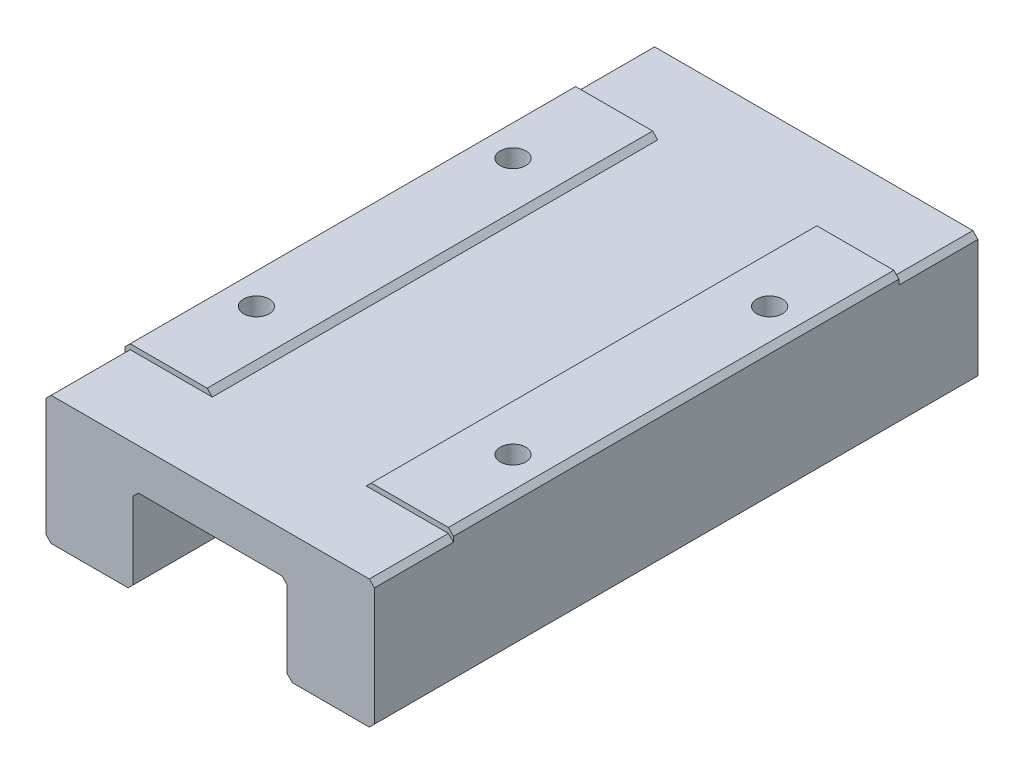
from build123d import *

# Parameters (mm, degrees)
SKETCH1_W                 = 32
SKETCH1_H                 = 43.4
SKETCH1_H_2               = 7.7
BOSS_EXTRUDE1_DEPTH       = 13
M3X0_5_TAPPED_HOLE1_D     = 2.5
M3X0_5_TAPPED_HOLE1_DEPTH = 6.5
M3X0_5_TAPPED_HOLE1_TIP   = 0.751075774
CUT_EXTRUDE1_DEPTH        = 69.194134645
SKETCH5_W                 = 15
SKETCH5_H                 = 43.4
CUT_EXTRUDE2_DEPTH        = 0.5
CHAMFER1_SIZE             = 0.5


with BuildPart() as part:
    # Sketch1 → Boss-Extrude1 (new body)
    with BuildSketch(Plane(origin=(0, 0, 0), x_dir=(1, 0, 0), z_dir=(0, 1, 0))):
        with Locations((16, 29.4)):
            Rectangle(SKETCH1_W, SKETCH1_H)
        with Locations((16, 3.85)):
            Rectangle(SKETCH1_W, SKETCH1_H_2)
        with Locations((16, 54.95)):
            Rectangle(SKETCH1_W, SKETCH1_H_2)
    extrude(amount=BOSS_EXTRUDE1_DEPTH)

    # M3x0.5 Tapped Hole1
    with Locations(Plane(origin=(0, 13, 0), x_dir=(1, 0, 0), z_dir=(0, 1, 0))):
        with Locations((28.5, 17), (28.5, 42), (3.5, 42), (3.5, 17)):
            Hole(M3X0_5_TAPPED_HOLE1_D / 2, depth=M3X0_5_TAPPED_HOLE1_DEPTH)
            with Locations((0, 0, -(M3X0_5_TAPPED_HOLE1_DEPTH + M3X0_5_TAPPED_HOLE1_TIP / 2))):  # 118° drill point
                Cone(0, M3X0_5_TAPPED_HOLE1_D / 2, M3X0_5_TAPPED_HOLE1_TIP, mode=Mode.SUBTRACT)

    # Sketch4 → Cut-Extrude1 (cut, through all)
    with BuildSketch(Plane.XY):
        Polygon((8.5, 8.5), (8.5, 0), (23.5, 0), (23.5, 8.5), (16, 8.5), align=None)
    extrude(amount=-CUT_EXTRUDE1_DEPTH, mode=Mode.SUBTRACT)

    # Sketch5 → Cut-Extrude2 (cut)
    with BuildSketch(Plane(origin=(0, 13, 0), x_dir=(1, 0, 0), z_dir=(0, 1, 0))):
        Polygon((0, 58.8), (0, 51.1), (8.5, 51.1), (23.5, 51.1), (32, 51.1), (32, 58.8), align=None)
        Polygon((8.5, 7.7), (0, 7.7), (0, 0), (32, 0), (32, 7.7), (23.5, 7.7), align=None)
        with Locations((16, 29.4)):
            Rectangle(SKETCH5_W, SKETCH5_H)
    extrude(amount=-CUT_EXTRUDE2_DEPTH, mode=Mode.SUBTRACT)

    # Chamfer1
    chamfer1_edges = [part.edges().sort_by_distance(p)[0] for p in [
        (0, 13, -29.4),
        (8.5, 13, -29.4),
        (0, 12.5, -3.85),
        (0, 12.5, -54.95),
        (0, 0, -29.4),
        (32, 12.5, -3.85),
        (32, 12.5, -54.95),
        (8.5, 0, -29.4),
        (8.5, 8.5, -29.4),
        (23.5, 8.5, -29.4),
        (23.5, 0, -29.4),
        (32, 0, -29.4),
        (32, 13, -29.4),
        (23.5, 13, -29.4),
    ]]
    chamfer(chamfer1_edges, length=CHAMFER1_SIZE - 0.0001)  # a hair under: the kernel refuses the full size


solid = part.part
